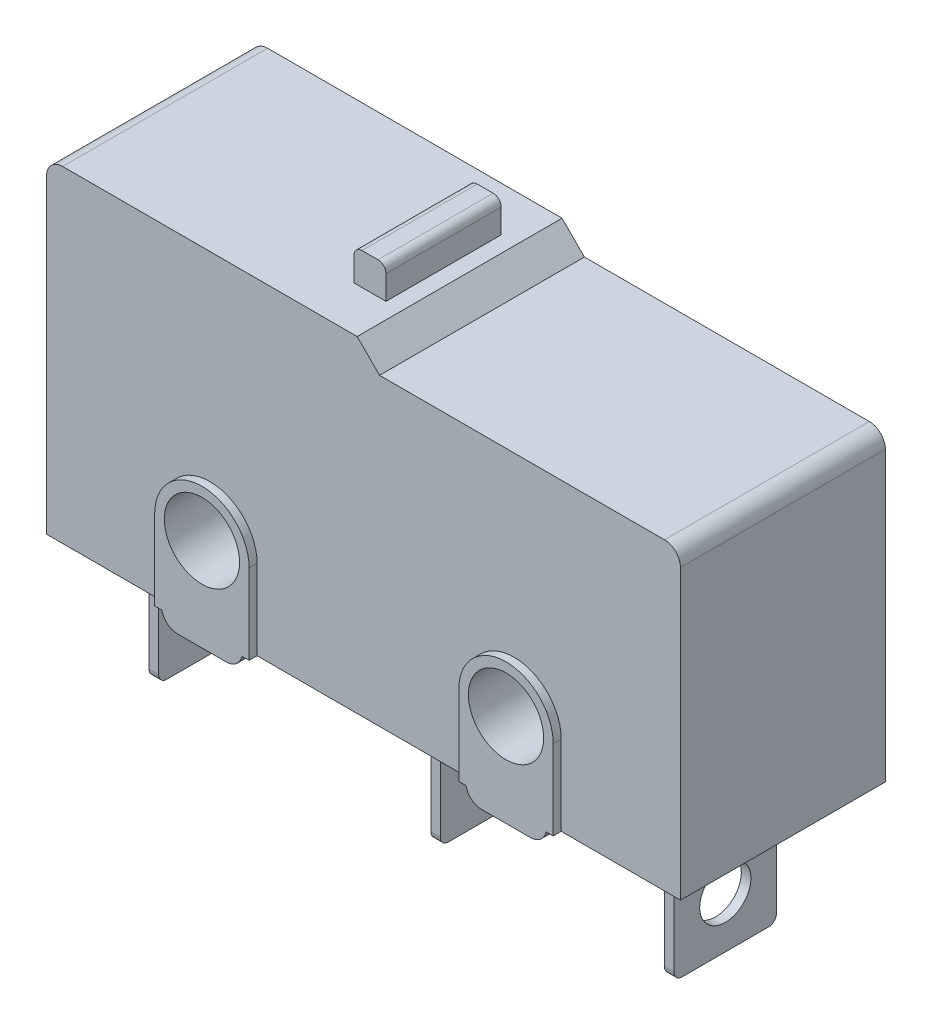
from build123d import *

# Parameters (mm, degrees)
SKETCH1_R                = 1.175
BOSS_EXTRUDE1_DEPTH      = 6.4
SKETCH2_W                = 1
SKETCH2_H                = 3.6
BOSS_EXTRUDE2_DEPTH      = 1
SKETCH3_W                = 0.3
SKETCH3_H                = 3.2
BOSS_EXTRUDE3_DEPTH      = 3.9
SKETCH4_R                = 0.8
CUT_EXTRUDE1_DEPTH       = 23.144976857
BOSS_EXTRUDE4_DEPTH      = 0.25
BOSS_EXTRUDE4_DEPTH_BACK = 6.65
SKETCH5_R                = 1.175
FILLET1_R                = 0.5
FILLET2_R                = 0.25
FILLET3_R                = 0.25


with BuildPart() as part:
    # Sketch1 → Boss-Extrude1 (new body)
    with BuildSketch(Plane.XY):
        Polygon((0, 0), (-3.95, 0), (-3.95, -0.4), (-6.45, -0.4), (-6.45, 0), (-13.45, 0), (-13.45, -0.4), (-15.95, -0.4), (-15.95, 0), (-19.8, 0), (-19.8, 10.2), (-10.1, 10.2), (-9.4, 9.5), (0, 9.5), align=None)
        with Locations((-14.7, 2.5)):
            Circle(SKETCH1_R, mode=Mode.SUBTRACT)
        with Locations((-5.2, 2.5)):
            Circle(SKETCH1_R, mode=Mode.SUBTRACT)
    extrude(amount=BOSS_EXTRUDE1_DEPTH)

    # Sketch2 → Boss-Extrude2 (add)
    with BuildSketch(Plane(origin=(0, 10.2, 0), x_dir=(1, 0, 0), z_dir=(0, 1, 0))):
        with Locations((-11.1, -3.2)):
            Rectangle(SKETCH2_W, SKETCH2_H)
    extrude(amount=BOSS_EXTRUDE2_DEPTH)

    # Sketch3 → Boss-Extrude3 (add)
    with BuildSketch(Plane.XZ):
        with Locations((-18.05, 3.2)):
            Rectangle(SKETCH3_W, SKETCH3_H)
        with Locations((-9.25, 3.2)):
            Rectangle(SKETCH3_W, SKETCH3_H)
        with Locations((-1.95, 3.2)):
            Rectangle(SKETCH3_W, SKETCH3_H)
    extrude(amount=BOSS_EXTRUDE3_DEPTH)

    # Sketch4 → Cut-Extrude1 (cut, through all)
    with BuildSketch(Plane(origin=(-1.8, 0, 0), x_dir=(0, 0, -1), z_dir=(1, 0, 0))):
        with Locations(Location((-3.2, -2.3, 0), (0, 0, 90))):
            Circle(SKETCH4_R)
    extrude(amount=-CUT_EXTRUDE1_DEPTH, mode=Mode.SUBTRACT)

    # Sketch5 → Boss-Extrude4 (add, two sides: drawn at the far end of the back side and taken through both)
    # profile 1 of 2: a face of its own
    with BuildSketch(Plane.XY.offset(6.4).offset(-BOSS_EXTRUDE4_DEPTH_BACK)):
        with BuildLine():
            Line((-16.175, 2.5), (-16.175, 0))
            Line((-16.175, 0), (-15.95, 0))
            Line((-15.95, 0), (-15.95, -0.4))
            Line((-15.95, -0.4), (-13.45, -0.4))
            Line((-13.45, -0.4), (-13.45, 0))
            Line((-13.45, 0), (-13.225, 0))
            Line((-13.225, 0), (-13.225, 2.5))
            ThreePointArc((-13.225, 2.5), (-14.7, 3.975), (-16.175, 2.5))
        make_face()
        with Locations(Location((-14.7, 2.5, 0), (0, 0, 180))):
            Circle(SKETCH5_R, mode=Mode.SUBTRACT)
    # profile 2 of 2: a face of its own
    with BuildSketch(Plane.XY.offset(6.4).offset(-BOSS_EXTRUDE4_DEPTH_BACK)):
        with BuildLine():
            Line((-6.675, 2.5), (-6.675, 0))
            Line((-6.675, 0), (-6.45, 0))
            Line((-6.45, 0), (-6.45, -0.4))
            Line((-6.45, -0.4), (-3.95, -0.4))
            Line((-3.95, -0.4), (-3.95, 0))
            Line((-3.95, 0), (-3.725, 0))
            Line((-3.725, 0), (-3.725, 2.5))
            ThreePointArc((-3.725, 2.5), (-5.2, 3.975), (-6.675, 2.5))
        make_face()
        with Locations(Location((-5.2, 2.5, 0), (0, 0, 180))):
            Circle(SKETCH5_R, mode=Mode.SUBTRACT)
    extrude(amount=BOSS_EXTRUDE4_DEPTH + BOSS_EXTRUDE4_DEPTH_BACK)

    # Fillet1
    # the kernel refuses this fillet: 0.5 mm, written as the material it takes off along each edge
    with BuildSketch(Plane(origin=(-19.8, 10.2, -1.25), x_dir=(0, -1, 0), z_dir=(0, 0, 1)), Plane(origin=(0, 9.5, -1.25), x_dir=(-1, 0, 0), z_dir=(0, 0, 1))) as fillet1_piece_1:
        with BuildLine():
            CenterArc((FILLET1_R, FILLET1_R), FILLET1_R, 180, 90)
            Line((0, FILLET1_R), (-FILLET1_R * 0.02, FILLET1_R))
            Line((-FILLET1_R * 0.02, FILLET1_R), (-FILLET1_R * 0.02, -FILLET1_R * 0.02))
            Line((-FILLET1_R * 0.02, -FILLET1_R * 0.02), (FILLET1_R, -FILLET1_R * 0.02))
            Line((FILLET1_R, -FILLET1_R * 0.02), (FILLET1_R, 0))
        make_face()
    extrude(amount=8.9, mode=Mode.SUBTRACT)
    with BuildSketch(Plane(origin=(-3.95, -0.4, 7.874744871), x_dir=(-1, 0, 0), z_dir=(0, 0, -1))) as fillet1_piece_2:
        with BuildLine():
            CenterArc((0.489897949, 0.5), FILLET1_R, 191.536959033, 78.463040967)
            Line((0, 0.4), (-0.009797959, 0.398))
            ThreePointArc((-0.009797959, 0.398), (-0.01, 0.2), (-0.01, 0))
            Line((-0.01, 0), (0, -0.01))
            Line((0, -0.01), (0.489897949, -0.01))
            Line((0.489897949, -0.01), (0.489897949, 0))
        make_face()
    extrude(amount=9.349489743, mode=Mode.SUBTRACT)
    with BuildSketch(Plane(origin=(-6.45, -0.4, 0), x_dir=(1, 0, 0), z_dir=(0, 0, 1))) as fillet1_piece_3:
        with BuildLine():
            CenterArc((0.489897949, 0.5), FILLET1_R, 191.536959033, 78.463040967)
            Line((0, 0.4), (-0.009797959, 0.398))
            ThreePointArc((-0.009797959, 0.398), (-0.01, 0.2), (-0.01, 0))
            Line((-0.01, 0), (0, -0.01))
            Line((0, -0.01), (0.489897949, -0.01))
            Line((0.489897949, -0.01), (0.489897949, 0))
        make_face()
    extrude(amount=6.4, mode=Mode.SUBTRACT)
    with BuildSketch(Plane(origin=(-13.45, -0.4, -1.474744871), x_dir=(-1, 0, 0), z_dir=(0, 0, 1))) as fillet1_piece_4:
        with BuildLine():
            CenterArc((0.489897949, -0.5), FILLET1_R, 90, 78.463040967)
            Line((0, -0.4), (-0.009797959, -0.398))
            ThreePointArc((-0.009797959, -0.398), (-0.01, -0.2), (-0.01, 0))
            Line((-0.01, 0), (0, 0.01))
            Line((0, 0.01), (0.489897949, 0.01))
            Line((0.489897949, 0.01), (0.489897949, 0))
        make_face()
    extrude(amount=9.349489743, mode=Mode.SUBTRACT)
    with BuildSketch(Plane(origin=(-15.95, -0.4, -1.474744871), x_dir=(0, 1, 0), z_dir=(0, 0, 1))) as fillet1_piece_5:
        with BuildLine():
            CenterArc((0.5, -0.489897949), FILLET1_R, 101.536959033, 78.463040967)
            Line((0, -0.489897949), (-0.01, -0.489897949))
            Line((-0.01, -0.489897949), (-0.01, 0))
            Line((-0.01, 0), (0, 0.01))
            ThreePointArc((0, 0.01), (0.2, 0.01), (0.398, 0.009797959))
            Line((0.398, 0.009797959), (0.4, 0))
        make_face()
    extrude(amount=9.349489743, mode=Mode.SUBTRACT)
    with BuildSketch(Plane(origin=(-6.45, -0.4, -1.474744871), x_dir=(1, 0, 0), z_dir=(0, 0, 1))) as fillet1_piece_6:
        with BuildLine():
            CenterArc((0.489897949, 0.5), FILLET1_R, 191.536959033, 78.463040967)
            Line((0, 0.4), (-0.009797959, 0.398))
            ThreePointArc((-0.009797959, 0.398), (-0.01, 0.2), (-0.01, 0))
            Line((-0.01, 0), (0, -0.01))
            Line((0, -0.01), (0.489897949, -0.01))
            Line((0.489897949, -0.01), (0.489897949, 0))
        make_face()
    extrude(amount=1.474744871, mode=Mode.SUBTRACT)
    with BuildSketch(Plane(origin=(-6.45, -0.4, 6.4), x_dir=(1.578737141016463e-12, 1.0, 0), z_dir=(0, 0, 1))) as fillet1_piece_7:
        with BuildLine():
            CenterArc((0.5, -0.489897949), FILLET1_R, 101.536959033, 78.463040967)
            Line((0, -0.489897949), (-0.01, -0.489897949))
            Line((-0.01, -0.489897949), (-0.01, 0))
            Line((-0.01, 0), (0, 0.01))
            ThreePointArc((0, 0.01), (0.2, 0.01), (0.398, 0.009797959))
            Line((0.398, 0.009797959), (0.4, 0))
        make_face()
    extrude(amount=1.474744871, mode=Mode.SUBTRACT)

    # Fillet2
    fillet2_edges = [part.edges().sort_by_distance(p)[0] for p in [
        (-18.05, -3.9, 1.6),
        (-18.05, -3.9, 4.8),
        (-9.25, -3.9, 1.6),
        (-9.25, -3.9, 4.8),
        (-1.95, -3.9, 1.6),
        (-1.95, -3.9, 4.8),
    ]]
    fillet(fillet2_edges, radius=FILLET2_R)

    # Fillet3
    fillet3_edges = [part.edges().sort_by_distance(p)[0] for p in [
        (-11.6, 11.2, 3.2),
        (-10.6, 11.2, 3.2),
    ]]
    fillet(fillet3_edges, radius=FILLET3_R)


solid = part.part
